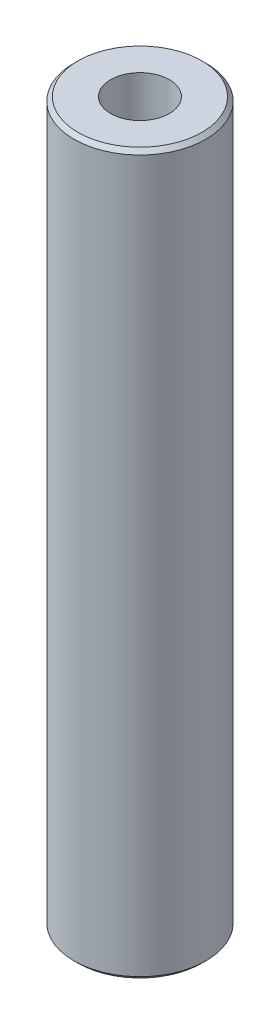
from build123d import *

# Parameters (mm, degrees)
SKETCH1_R           = 55
BOSS_EXTRUDE1_DEPTH = 600
SKETCH2_R           = 24.488620205
CUT_EXTRUDE1_DEPTH  = 606.020660804
CHAMFER1_SIZE       = 3.321402857


with BuildPart() as part:
    # Sketch1 → Boss-Extrude1 (new body)
    with BuildSketch(Plane(origin=(0, 0, 0), x_dir=(1, 0, 0), z_dir=(0, 1, 0))):
        Circle(SKETCH1_R)
    extrude(amount=BOSS_EXTRUDE1_DEPTH)

    # Sketch2 → Cut-Extrude1 (cut, through all)
    with BuildSketch(Plane(origin=(0, 0, 0), x_dir=(1, 0, 0), z_dir=(0, 1, 0))):
        Circle(SKETCH2_R)
    extrude(amount=CUT_EXTRUDE1_DEPTH, mode=Mode.SUBTRACT)

    # Chamfer1
    chamfer1_edges = [part.edges().sort_by_distance(p)[0] for p in [
        (-55, 600, 0),
        (-55, 0, 0),
    ]]
    chamfer(chamfer1_edges, length=CHAMFER1_SIZE)


solid = part.part
